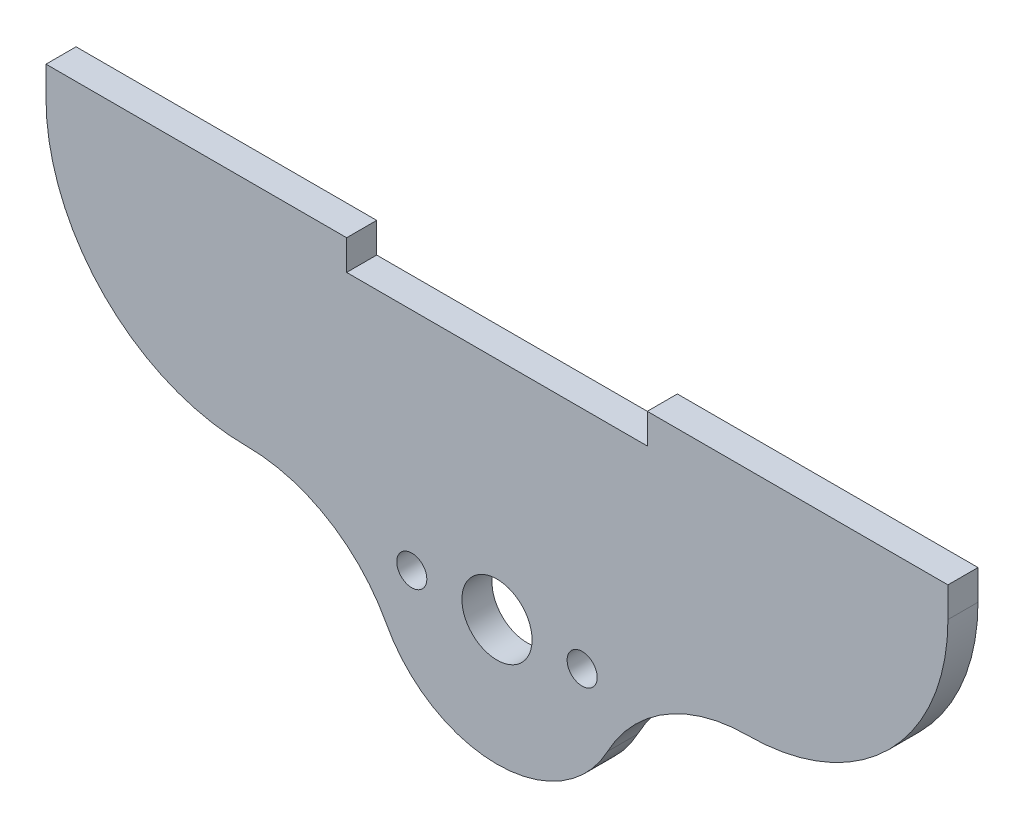
from build123d import *

# Parameters (mm, degrees)
SKETCH1_R           = 1.5
SKETCH1_R_2         = 3.5
BOSS_EXTRUDE1_DEPTH = 3


with BuildPart() as part:
    # Sketch1 → Boss-Extrude1 (new body)
    with BuildSketch(Plane.XY):
        with BuildLine():
            Line((-15, 22.5), (15, 22.5))
            Line((15, 22.5), (15, 25.5))
            Line((15, 25.5), (45, 25.5))
            Line((45, 25.5), (45, 22.5))
            ThreePointArc((45, 22.5), (39.142135624, 8.357864376), (25, 2.5))
            ThreePointArc((25, 2.5), (16.853817206, 0.24363799), (11.029411765, -5.882352941))
            ThreePointArc((11.029411765, -5.882352941), (0, -12.5), (-11.029411765, -5.882352941))
            ThreePointArc((-11.029411765, -5.882352941), (-16.853817206, 0.24363799), (-25, 2.5))
            ThreePointArc((-25, 2.5), (-39.142135624, 8.357864376), (-45, 22.5))
            Line((-45, 22.5), (-45, 25.5))
            Line((-45, 25.5), (-15, 25.5))
            Line((-15, 25.5), (-15, 22.5))
        make_face()
        with Locations((-8.5, 0)):
            Circle(SKETCH1_R, mode=Mode.SUBTRACT)
        with Locations((8.5, 0)):
            Circle(SKETCH1_R, mode=Mode.SUBTRACT)
        Circle(SKETCH1_R_2, mode=Mode.SUBTRACT)
    extrude(amount=BOSS_EXTRUDE1_DEPTH)


solid = part.part
